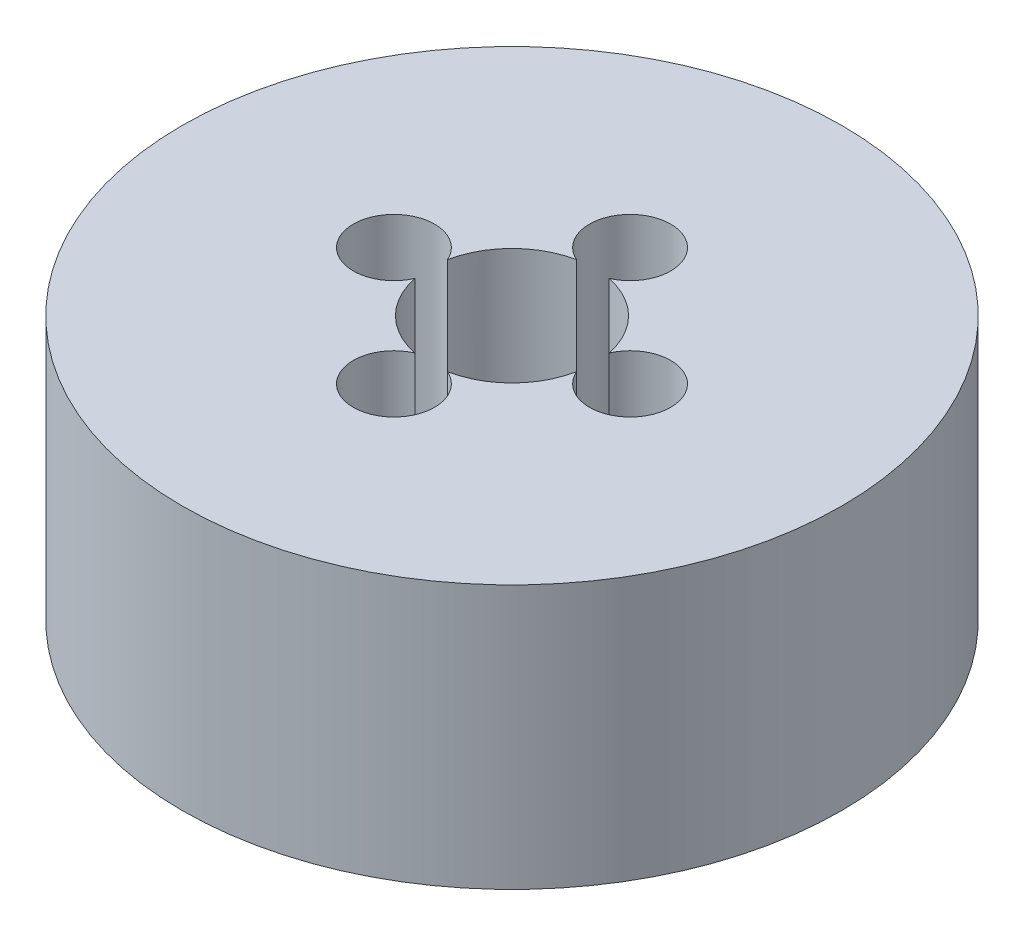
from build123d import *

# Parameters (mm, degrees)
SKETCH1_R           = 20
BOSS_EXTRUDE1_DEPTH = 16
SKETCH2_R           = 5
CUT_EXTRUDE1_DEPTH  = 33.496153619
SKETCH3_R           = 2.46551126
CUT_EXTRUDE2_DEPTH  = 12.396498625
CIRPATTERN1_COUNT   = 4


with BuildPart() as part:
    # Sketch1 → Boss-Extrude1 (new body)
    with BuildSketch(Plane(origin=(0, 0, 0), x_dir=(1, 0, 0), z_dir=(0, 1, 0))):
        Circle(SKETCH1_R)
    extrude(amount=BOSS_EXTRUDE1_DEPTH)

    # Sketch2 → Cut-Extrude1 (cut, through all)
    with BuildSketch(Plane(origin=(0, 0, 0), x_dir=(1, 0, 0), z_dir=(0, 1, 0))):
        Circle(SKETCH2_R)
    extrude(amount=CUT_EXTRUDE1_DEPTH, mode=Mode.SUBTRACT)

    # Sketch3 → Cut-Extrude2 (cut)
    with BuildSketch(Plane(origin=(0, 16, 0), x_dir=(1, 0, 0), z_dir=(0, 1, 0))):
        with Locations((-7.162628866, 0)):
            Circle(SKETCH3_R)
    cut_extrude2 = extrude(amount=-CUT_EXTRUDE2_DEPTH, mode=Mode.SUBTRACT)

    # CirPattern1: Cut-Extrude2 ×4 about axis
    cirpattern1_axis = Axis((0, 0, 0), (0, 1, 0))
    for i in range(1, CIRPATTERN1_COUNT):
        add(cut_extrude2.rotate(cirpattern1_axis, i * 360 / CIRPATTERN1_COUNT), mode=Mode.SUBTRACT)


solid = part.part
